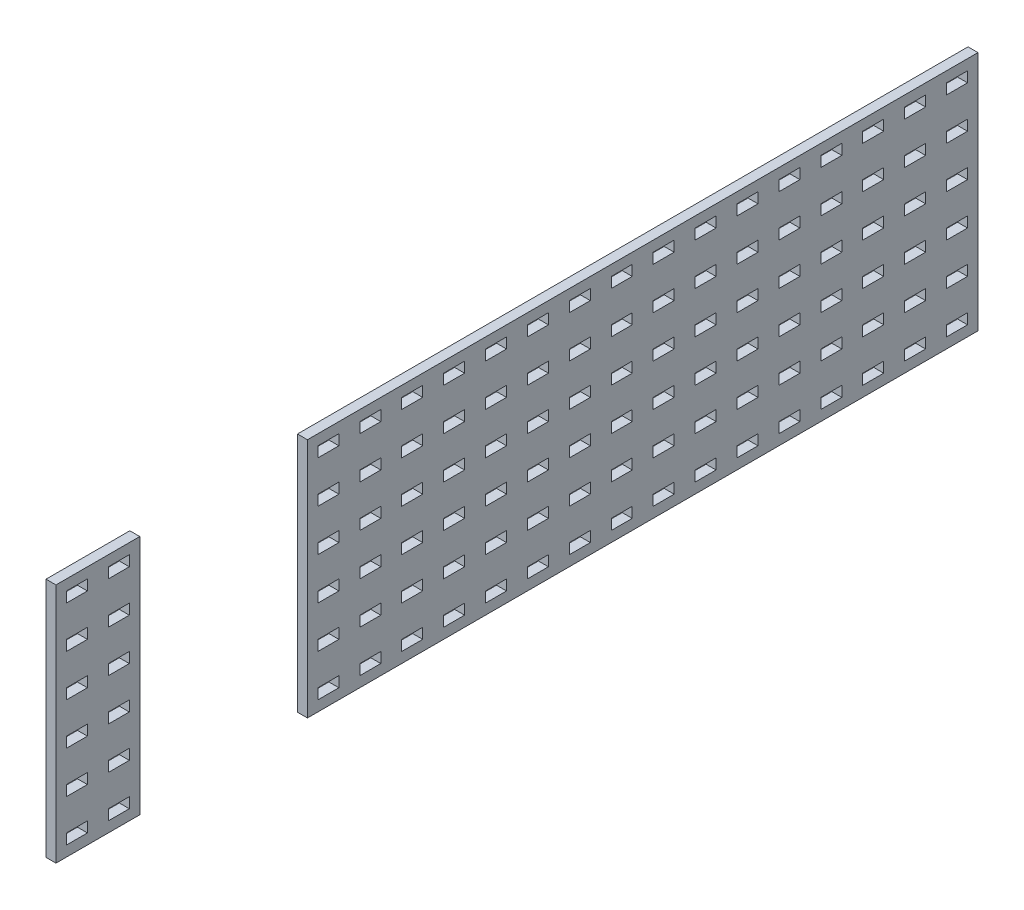
from build123d import *

# Parameters (mm, degrees)
SKETCH1_W           = 558.8
SKETCH1_H           = 146.05
BOSS_EXTRUDE1_DEPTH = 3.0226
SKETCH2_W           = 12.7
SKETCH2_H           = 6.35
CUT_EXTRUDE1_DEPTH  = 289.84867157
SKETCH3_W           = 101.6
SKETCH3_H           = 146.05
CUT_EXTRUDE2_DEPTH  = 289.84867157


with BuildPart() as part:
    # Sketch1 → Boss-Extrude1 (new, symmetric)
    with BuildSketch(Plane(origin=(0, 0, 0), x_dir=(0, 0, -1), z_dir=(1, 0, 0))):
        Rectangle(SKETCH1_W, SKETCH1_H)
    extrude(amount=BOSS_EXTRUDE1_DEPTH, both=True)

    # Sketch2 → Cut-Extrude1 (cut, through all)
    with BuildSketch(Plane(origin=(3.0226, 0, 0), x_dir=(0, 0, -1), z_dir=(1, 0, 0))):
        with Locations((266.7, -63.5)):
            Rectangle(SKETCH2_W, SKETCH2_H)
        with Locations((241.3, -63.5)):
            Rectangle(SKETCH2_W, SKETCH2_H)
        with Locations((215.9, -63.5)):
            Rectangle(SKETCH2_W, SKETCH2_H)
        with Locations((190.5, -63.5)):
            Rectangle(SKETCH2_W, SKETCH2_H)
        with Locations((165.1, -63.5)):
            Rectangle(SKETCH2_W, SKETCH2_H)
        with Locations((139.7, -63.5)):
            Rectangle(SKETCH2_W, SKETCH2_H)
        with Locations((114.3, -63.5)):
            Rectangle(SKETCH2_W, SKETCH2_H)
        with Locations((88.9, -63.5)):
            Rectangle(SKETCH2_W, SKETCH2_H)
        with Locations((63.5, -63.5)):
            Rectangle(SKETCH2_W, SKETCH2_H)
        with Locations((38.1, -63.5)):
            Rectangle(SKETCH2_W, SKETCH2_H)
        with Locations((12.7, -63.5)):
            Rectangle(SKETCH2_W, SKETCH2_H)
        with Locations((-12.7, -63.5)):
            Rectangle(SKETCH2_W, SKETCH2_H)
        with Locations((-38.1, -63.5)):
            Rectangle(SKETCH2_W, SKETCH2_H)
        with Locations((-63.5, -63.5)):
            Rectangle(SKETCH2_W, SKETCH2_H)
        with Locations((-88.9, -63.5)):
            Rectangle(SKETCH2_W, SKETCH2_H)
        with Locations((-114.3, -63.5)):
            Rectangle(SKETCH2_W, SKETCH2_H)
        with Locations((-139.7, -63.5)):
            Rectangle(SKETCH2_W, SKETCH2_H)
        with Locations((-165.1, -63.5)):
            Rectangle(SKETCH2_W, SKETCH2_H)
        with Locations((-190.5, -63.5)):
            Rectangle(SKETCH2_W, SKETCH2_H)
        with Locations((-215.9, -63.5)):
            Rectangle(SKETCH2_W, SKETCH2_H)
        with Locations((-241.3, -63.5)):
            Rectangle(SKETCH2_W, SKETCH2_H)
        with Locations((-266.7, -63.5)):
            Rectangle(SKETCH2_W, SKETCH2_H)
        with Locations((241.3, -38.1)):
            Rectangle(SKETCH2_W, SKETCH2_H)
        with Locations((215.9, -38.1)):
            Rectangle(SKETCH2_W, SKETCH2_H)
        with Locations((190.5, -38.1)):
            Rectangle(SKETCH2_W, SKETCH2_H)
        with Locations((165.1, -38.1)):
            Rectangle(SKETCH2_W, SKETCH2_H)
        with Locations((139.7, -38.1)):
            Rectangle(SKETCH2_W, SKETCH2_H)
        with Locations((114.3, -38.1)):
            Rectangle(SKETCH2_W, SKETCH2_H)
        with Locations((88.9, -38.1)):
            Rectangle(SKETCH2_W, SKETCH2_H)
        with Locations((63.5, -38.1)):
            Rectangle(SKETCH2_W, SKETCH2_H)
        with Locations((38.1, -38.1)):
            Rectangle(SKETCH2_W, SKETCH2_H)
        with Locations((12.7, -38.1)):
            Rectangle(SKETCH2_W, SKETCH2_H)
        with Locations((-12.7, -38.1)):
            Rectangle(SKETCH2_W, SKETCH2_H)
        with Locations((-38.1, -38.1)):
            Rectangle(SKETCH2_W, SKETCH2_H)
        with Locations((-63.5, -38.1)):
            Rectangle(SKETCH2_W, SKETCH2_H)
        with Locations((-88.9, -38.1)):
            Rectangle(SKETCH2_W, SKETCH2_H)
        with Locations((-114.3, -38.1)):
            Rectangle(SKETCH2_W, SKETCH2_H)
        with Locations((-139.7, -38.1)):
            Rectangle(SKETCH2_W, SKETCH2_H)
        with Locations((-165.1, -38.1)):
            Rectangle(SKETCH2_W, SKETCH2_H)
        with Locations((-190.5, -38.1)):
            Rectangle(SKETCH2_W, SKETCH2_H)
        with Locations((-215.9, -38.1)):
            Rectangle(SKETCH2_W, SKETCH2_H)
        with Locations((-241.3, -38.1)):
            Rectangle(SKETCH2_W, SKETCH2_H)
        with Locations((-266.7, -38.1)):
            Rectangle(SKETCH2_W, SKETCH2_H)
        with Locations((241.3, -12.7)):
            Rectangle(SKETCH2_W, SKETCH2_H)
        with Locations((215.9, -12.7)):
            Rectangle(SKETCH2_W, SKETCH2_H)
        with Locations((190.5, -12.7)):
            Rectangle(SKETCH2_W, SKETCH2_H)
        with Locations((165.1, -12.7)):
            Rectangle(SKETCH2_W, SKETCH2_H)
        with Locations((139.7, -12.7)):
            Rectangle(SKETCH2_W, SKETCH2_H)
        with Locations((114.3, -12.7)):
            Rectangle(SKETCH2_W, SKETCH2_H)
        with Locations((88.9, -12.7)):
            Rectangle(SKETCH2_W, SKETCH2_H)
        with Locations((63.5, -12.7)):
            Rectangle(SKETCH2_W, SKETCH2_H)
        with Locations((38.1, -12.7)):
            Rectangle(SKETCH2_W, SKETCH2_H)
        with Locations((12.7, -12.7)):
            Rectangle(SKETCH2_W, SKETCH2_H)
        with Locations((-12.7, -12.7)):
            Rectangle(SKETCH2_W, SKETCH2_H)
        with Locations((-38.1, -12.7)):
            Rectangle(SKETCH2_W, SKETCH2_H)
        with Locations((-63.5, -12.7)):
            Rectangle(SKETCH2_W, SKETCH2_H)
        with Locations((-88.9, -12.7)):
            Rectangle(SKETCH2_W, SKETCH2_H)
        with Locations((-114.3, -12.7)):
            Rectangle(SKETCH2_W, SKETCH2_H)
        with Locations((-139.7, -12.7)):
            Rectangle(SKETCH2_W, SKETCH2_H)
        with Locations((-165.1, -12.7)):
            Rectangle(SKETCH2_W, SKETCH2_H)
        with Locations((-190.5, -12.7)):
            Rectangle(SKETCH2_W, SKETCH2_H)
        with Locations((-215.9, -12.7)):
            Rectangle(SKETCH2_W, SKETCH2_H)
        with Locations((-241.3, -12.7)):
            Rectangle(SKETCH2_W, SKETCH2_H)
        with Locations((-266.7, -12.7)):
            Rectangle(SKETCH2_W, SKETCH2_H)
        with Locations((241.3, 12.7)):
            Rectangle(SKETCH2_W, SKETCH2_H)
        with Locations((215.9, 12.7)):
            Rectangle(SKETCH2_W, SKETCH2_H)
        with Locations((190.5, 12.7)):
            Rectangle(SKETCH2_W, SKETCH2_H)
        with Locations((165.1, 12.7)):
            Rectangle(SKETCH2_W, SKETCH2_H)
        with Locations((139.7, 12.7)):
            Rectangle(SKETCH2_W, SKETCH2_H)
        with Locations((114.3, 12.7)):
            Rectangle(SKETCH2_W, SKETCH2_H)
        with Locations((88.9, 12.7)):
            Rectangle(SKETCH2_W, SKETCH2_H)
        with Locations((63.5, 12.7)):
            Rectangle(SKETCH2_W, SKETCH2_H)
        with Locations((38.1, 12.7)):
            Rectangle(SKETCH2_W, SKETCH2_H)
        with Locations((12.7, 12.7)):
            Rectangle(SKETCH2_W, SKETCH2_H)
        with Locations((-12.7, 12.7)):
            Rectangle(SKETCH2_W, SKETCH2_H)
        with Locations((-38.1, 12.7)):
            Rectangle(SKETCH2_W, SKETCH2_H)
        with Locations((-63.5, 12.7)):
            Rectangle(SKETCH2_W, SKETCH2_H)
        with Locations((-88.9, 12.7)):
            Rectangle(SKETCH2_W, SKETCH2_H)
        with Locations((-114.3, 12.7)):
            Rectangle(SKETCH2_W, SKETCH2_H)
        with Locations((-139.7, 12.7)):
            Rectangle(SKETCH2_W, SKETCH2_H)
        with Locations((-165.1, 12.7)):
            Rectangle(SKETCH2_W, SKETCH2_H)
        with Locations((-190.5, 12.7)):
            Rectangle(SKETCH2_W, SKETCH2_H)
        with Locations((-215.9, 12.7)):
            Rectangle(SKETCH2_W, SKETCH2_H)
        with Locations((-241.3, 12.7)):
            Rectangle(SKETCH2_W, SKETCH2_H)
        with Locations((-266.7, 12.7)):
            Rectangle(SKETCH2_W, SKETCH2_H)
        with Locations((241.3, 38.1)):
            Rectangle(SKETCH2_W, SKETCH2_H)
        with Locations((215.9, 38.1)):
            Rectangle(SKETCH2_W, SKETCH2_H)
        with Locations((190.5, 38.1)):
            Rectangle(SKETCH2_W, SKETCH2_H)
        with Locations((165.1, 38.1)):
            Rectangle(SKETCH2_W, SKETCH2_H)
        with Locations((139.7, 38.1)):
            Rectangle(SKETCH2_W, SKETCH2_H)
        with Locations((114.3, 38.1)):
            Rectangle(SKETCH2_W, SKETCH2_H)
        with Locations((88.9, 38.1)):
            Rectangle(SKETCH2_W, SKETCH2_H)
        with Locations((63.5, 38.1)):
            Rectangle(SKETCH2_W, SKETCH2_H)
        with Locations((38.1, 38.1)):
            Rectangle(SKETCH2_W, SKETCH2_H)
        with Locations((12.7, 38.1)):
            Rectangle(SKETCH2_W, SKETCH2_H)
        with Locations((-12.7, 38.1)):
            Rectangle(SKETCH2_W, SKETCH2_H)
        with Locations((-38.1, 38.1)):
            Rectangle(SKETCH2_W, SKETCH2_H)
        with Locations((-63.5, 38.1)):
            Rectangle(SKETCH2_W, SKETCH2_H)
        with Locations((-88.9, 38.1)):
            Rectangle(SKETCH2_W, SKETCH2_H)
        with Locations((-114.3, 38.1)):
            Rectangle(SKETCH2_W, SKETCH2_H)
        with Locations((-139.7, 38.1)):
            Rectangle(SKETCH2_W, SKETCH2_H)
        with Locations((-165.1, 38.1)):
            Rectangle(SKETCH2_W, SKETCH2_H)
        with Locations((-190.5, 38.1)):
            Rectangle(SKETCH2_W, SKETCH2_H)
        with Locations((-215.9, 38.1)):
            Rectangle(SKETCH2_W, SKETCH2_H)
        with Locations((-241.3, 38.1)):
            Rectangle(SKETCH2_W, SKETCH2_H)
        with Locations((-266.7, 38.1)):
            Rectangle(SKETCH2_W, SKETCH2_H)
        with Locations((241.3, 63.5)):
            Rectangle(SKETCH2_W, SKETCH2_H)
        with Locations((215.9, 63.5)):
            Rectangle(SKETCH2_W, SKETCH2_H)
        with Locations((190.5, 63.5)):
            Rectangle(SKETCH2_W, SKETCH2_H)
        with Locations((165.1, 63.5)):
            Rectangle(SKETCH2_W, SKETCH2_H)
        with Locations((139.7, 63.5)):
            Rectangle(SKETCH2_W, SKETCH2_H)
        with Locations((114.3, 63.5)):
            Rectangle(SKETCH2_W, SKETCH2_H)
        with Locations((88.9, 63.5)):
            Rectangle(SKETCH2_W, SKETCH2_H)
        with Locations((63.5, 63.5)):
            Rectangle(SKETCH2_W, SKETCH2_H)
        with Locations((38.1, 63.5)):
            Rectangle(SKETCH2_W, SKETCH2_H)
        with Locations((12.7, 63.5)):
            Rectangle(SKETCH2_W, SKETCH2_H)
        with Locations((-12.7, 63.5)):
            Rectangle(SKETCH2_W, SKETCH2_H)
        with Locations((-38.1, 63.5)):
            Rectangle(SKETCH2_W, SKETCH2_H)
        with Locations((-63.5, 63.5)):
            Rectangle(SKETCH2_W, SKETCH2_H)
        with Locations((-88.9, 63.5)):
            Rectangle(SKETCH2_W, SKETCH2_H)
        with Locations((-114.3, 63.5)):
            Rectangle(SKETCH2_W, SKETCH2_H)
        with Locations((-139.7, 63.5)):
            Rectangle(SKETCH2_W, SKETCH2_H)
        with Locations((-165.1, 63.5)):
            Rectangle(SKETCH2_W, SKETCH2_H)
        with Locations((-190.5, 63.5)):
            Rectangle(SKETCH2_W, SKETCH2_H)
        with Locations((-215.9, 63.5)):
            Rectangle(SKETCH2_W, SKETCH2_H)
        with Locations((-241.3, 63.5)):
            Rectangle(SKETCH2_W, SKETCH2_H)
        with Locations((-266.7, 63.5)):
            Rectangle(SKETCH2_W, SKETCH2_H)
        with Locations((241.3, 88.9)):
            Rectangle(SKETCH2_W, SKETCH2_H)
        with Locations((215.9, 88.9)):
            Rectangle(SKETCH2_W, SKETCH2_H)
        with Locations((190.5, 88.9)):
            Rectangle(SKETCH2_W, SKETCH2_H)
        with Locations((165.1, 88.9)):
            Rectangle(SKETCH2_W, SKETCH2_H)
        with Locations((139.7, 88.9)):
            Rectangle(SKETCH2_W, SKETCH2_H)
        with Locations((114.3, 88.9)):
            Rectangle(SKETCH2_W, SKETCH2_H)
        with Locations((88.9, 88.9)):
            Rectangle(SKETCH2_W, SKETCH2_H)
        with Locations((63.5, 88.9)):
            Rectangle(SKETCH2_W, SKETCH2_H)
        with Locations((38.1, 88.9)):
            Rectangle(SKETCH2_W, SKETCH2_H)
        with Locations((12.7, 88.9)):
            Rectangle(SKETCH2_W, SKETCH2_H)
        with Locations((-12.7, 88.9)):
            Rectangle(SKETCH2_W, SKETCH2_H)
        with Locations((-38.1, 88.9)):
            Rectangle(SKETCH2_W, SKETCH2_H)
        with Locations((-63.5, 88.9)):
            Rectangle(SKETCH2_W, SKETCH2_H)
        with Locations((-88.9, 88.9)):
            Rectangle(SKETCH2_W, SKETCH2_H)
        with Locations((-114.3, 88.9)):
            Rectangle(SKETCH2_W, SKETCH2_H)
        with Locations((-139.7, 88.9)):
            Rectangle(SKETCH2_W, SKETCH2_H)
        with Locations((-165.1, 88.9)):
            Rectangle(SKETCH2_W, SKETCH2_H)
        with Locations((-190.5, 88.9)):
            Rectangle(SKETCH2_W, SKETCH2_H)
        with Locations((-215.9, 88.9)):
            Rectangle(SKETCH2_W, SKETCH2_H)
        with Locations((-241.3, 88.9)):
            Rectangle(SKETCH2_W, SKETCH2_H)
        with Locations((-266.7, 88.9)):
            Rectangle(SKETCH2_W, SKETCH2_H)
        with Locations((241.3, 114.3)):
            Rectangle(SKETCH2_W, SKETCH2_H)
        with Locations((215.9, 114.3)):
            Rectangle(SKETCH2_W, SKETCH2_H)
        with Locations((190.5, 114.3)):
            Rectangle(SKETCH2_W, SKETCH2_H)
        with Locations((165.1, 114.3)):
            Rectangle(SKETCH2_W, SKETCH2_H)
        with Locations((139.7, 114.3)):
            Rectangle(SKETCH2_W, SKETCH2_H)
        with Locations((114.3, 114.3)):
            Rectangle(SKETCH2_W, SKETCH2_H)
        with Locations((88.9, 114.3)):
            Rectangle(SKETCH2_W, SKETCH2_H)
        with Locations((63.5, 114.3)):
            Rectangle(SKETCH2_W, SKETCH2_H)
        with Locations((38.1, 114.3)):
            Rectangle(SKETCH2_W, SKETCH2_H)
        with Locations((12.7, 114.3)):
            Rectangle(SKETCH2_W, SKETCH2_H)
        with Locations((-12.7, 114.3)):
            Rectangle(SKETCH2_W, SKETCH2_H)
        with Locations((-38.1, 114.3)):
            Rectangle(SKETCH2_W, SKETCH2_H)
        with Locations((-63.5, 114.3)):
            Rectangle(SKETCH2_W, SKETCH2_H)
        with Locations((-88.9, 114.3)):
            Rectangle(SKETCH2_W, SKETCH2_H)
        with Locations((-114.3, 114.3)):
            Rectangle(SKETCH2_W, SKETCH2_H)
        with Locations((-139.7, 114.3)):
            Rectangle(SKETCH2_W, SKETCH2_H)
        with Locations((-165.1, 114.3)):
            Rectangle(SKETCH2_W, SKETCH2_H)
        with Locations((-190.5, 114.3)):
            Rectangle(SKETCH2_W, SKETCH2_H)
        with Locations((-215.9, 114.3)):
            Rectangle(SKETCH2_W, SKETCH2_H)
        with Locations((-241.3, 114.3)):
            Rectangle(SKETCH2_W, SKETCH2_H)
        with Locations((-266.7, 114.3)):
            Rectangle(SKETCH2_W, SKETCH2_H)
        with Locations((241.3, 139.7)):
            Rectangle(SKETCH2_W, SKETCH2_H)
        with Locations((215.9, 139.7)):
            Rectangle(SKETCH2_W, SKETCH2_H)
        with Locations((190.5, 139.7)):
            Rectangle(SKETCH2_W, SKETCH2_H)
        with Locations((165.1, 139.7)):
            Rectangle(SKETCH2_W, SKETCH2_H)
        with Locations((139.7, 139.7)):
            Rectangle(SKETCH2_W, SKETCH2_H)
        with Locations((114.3, 139.7)):
            Rectangle(SKETCH2_W, SKETCH2_H)
        with Locations((88.9, 139.7)):
            Rectangle(SKETCH2_W, SKETCH2_H)
        with Locations((63.5, 139.7)):
            Rectangle(SKETCH2_W, SKETCH2_H)
        with Locations((38.1, 139.7)):
            Rectangle(SKETCH2_W, SKETCH2_H)
        with Locations((12.7, 139.7)):
            Rectangle(SKETCH2_W, SKETCH2_H)
        with Locations((-12.7, 139.7)):
            Rectangle(SKETCH2_W, SKETCH2_H)
        with Locations((-38.1, 139.7)):
            Rectangle(SKETCH2_W, SKETCH2_H)
        with Locations((-63.5, 139.7)):
            Rectangle(SKETCH2_W, SKETCH2_H)
        with Locations((-88.9, 139.7)):
            Rectangle(SKETCH2_W, SKETCH2_H)
        with Locations((-114.3, 139.7)):
            Rectangle(SKETCH2_W, SKETCH2_H)
        with Locations((-139.7, 139.7)):
            Rectangle(SKETCH2_W, SKETCH2_H)
        with Locations((-165.1, 139.7)):
            Rectangle(SKETCH2_W, SKETCH2_H)
        with Locations((-190.5, 139.7)):
            Rectangle(SKETCH2_W, SKETCH2_H)
        with Locations((-215.9, 139.7)):
            Rectangle(SKETCH2_W, SKETCH2_H)
        with Locations((-241.3, 139.7)):
            Rectangle(SKETCH2_W, SKETCH2_H)
        with Locations((-266.7, 139.7)):
            Rectangle(SKETCH2_W, SKETCH2_H)
        with Locations((241.3, 165.1)):
            Rectangle(SKETCH2_W, SKETCH2_H)
        with Locations((215.9, 165.1)):
            Rectangle(SKETCH2_W, SKETCH2_H)
        with Locations((190.5, 165.1)):
            Rectangle(SKETCH2_W, SKETCH2_H)
        with Locations((165.1, 165.1)):
            Rectangle(SKETCH2_W, SKETCH2_H)
        with Locations((139.7, 165.1)):
            Rectangle(SKETCH2_W, SKETCH2_H)
        with Locations((114.3, 165.1)):
            Rectangle(SKETCH2_W, SKETCH2_H)
        with Locations((88.9, 165.1)):
            Rectangle(SKETCH2_W, SKETCH2_H)
        with Locations((63.5, 165.1)):
            Rectangle(SKETCH2_W, SKETCH2_H)
        with Locations((38.1, 165.1)):
            Rectangle(SKETCH2_W, SKETCH2_H)
        with Locations((12.7, 165.1)):
            Rectangle(SKETCH2_W, SKETCH2_H)
        with Locations((-12.7, 165.1)):
            Rectangle(SKETCH2_W, SKETCH2_H)
        with Locations((-38.1, 165.1)):
            Rectangle(SKETCH2_W, SKETCH2_H)
        with Locations((-63.5, 165.1)):
            Rectangle(SKETCH2_W, SKETCH2_H)
        with Locations((-88.9, 165.1)):
            Rectangle(SKETCH2_W, SKETCH2_H)
        with Locations((-114.3, 165.1)):
            Rectangle(SKETCH2_W, SKETCH2_H)
        with Locations((-139.7, 165.1)):
            Rectangle(SKETCH2_W, SKETCH2_H)
        with Locations((-165.1, 165.1)):
            Rectangle(SKETCH2_W, SKETCH2_H)
        with Locations((-190.5, 165.1)):
            Rectangle(SKETCH2_W, SKETCH2_H)
        with Locations((-215.9, 165.1)):
            Rectangle(SKETCH2_W, SKETCH2_H)
        with Locations((-241.3, 165.1)):
            Rectangle(SKETCH2_W, SKETCH2_H)
        with Locations((-266.7, 165.1)):
            Rectangle(SKETCH2_W, SKETCH2_H)
        with Locations((266.7, -38.1)):
            Rectangle(SKETCH2_W, SKETCH2_H)
        with Locations((266.7, -12.7)):
            Rectangle(SKETCH2_W, SKETCH2_H)
        with Locations((266.7, 12.7)):
            Rectangle(SKETCH2_W, SKETCH2_H)
        with Locations((266.7, 38.1)):
            Rectangle(SKETCH2_W, SKETCH2_H)
        with Locations((266.7, 63.5)):
            Rectangle(SKETCH2_W, SKETCH2_H)
        with Locations((266.7, 88.9)):
            Rectangle(SKETCH2_W, SKETCH2_H)
        with Locations((266.7, 114.3)):
            Rectangle(SKETCH2_W, SKETCH2_H)
        with Locations((266.7, 139.7)):
            Rectangle(SKETCH2_W, SKETCH2_H)
        with Locations((266.7, 165.1)):
            Rectangle(SKETCH2_W, SKETCH2_H)
    extrude(amount=-CUT_EXTRUDE1_DEPTH, mode=Mode.SUBTRACT)

    # Sketch3 → Cut-Extrude2 (cut, through all)
    with BuildSketch(Plane(origin=(3.0226, 0, 0), x_dir=(0, 0, -1), z_dir=(1, 0, 0))):
        with Locations((-177.8, 0)):
            Rectangle(SKETCH3_W, SKETCH3_H)
    extrude(amount=-CUT_EXTRUDE2_DEPTH, mode=Mode.SUBTRACT)


with BuildPart() as cut_extrude2_piece_1:
    # of the separate pieces the step leaves, piece 1, a body of its own (cut_extrude2_pieces)
    add(part.part.solids().sort_by_distance((3.0226, -73.025, 127))[0])


with BuildPart() as cut_extrude2_piece_2:
    # of the separate pieces the step leaves, piece 2, a body of its own (cut_extrude2_pieces)
    add(part.part.solids().sort_by_distance((3.0226, -73.025, 279.4))[0])


solid = Compound([cut_extrude2_piece_1.part, cut_extrude2_piece_2.part])
